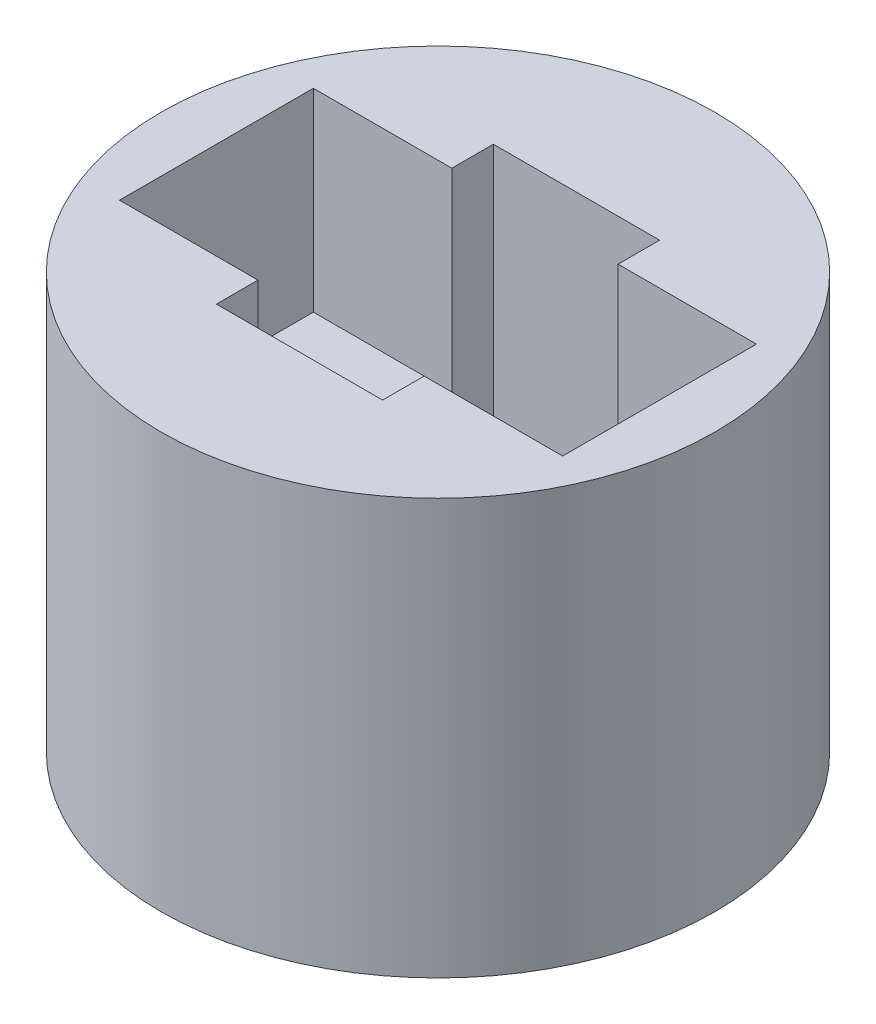
from build123d import *

# Parameters (mm, degrees)
CROQUIS1_W            = 5
CROQUIS1_H            = 7.5
CORTAR_EXTRUIR1_DEPTH = 11.307764064
CROQUIS3_W            = 8
CROQUIS3_H            = 3.5
CORTAR_EXTRUIR2_DEPTH = 3.5


with BuildPart() as part:
    # Croquis1 → Revolución1 (revolve)
    with BuildSketch(Plane.XY):
        with Locations((2.5, 3.75)):
            Rectangle(CROQUIS1_W, CROQUIS1_H)
    revolve(axis=Axis((0, 0, 0), (0, 1, 0)))

    # Croquis2 → Cortar-Extruir1 (cut, through all)
    with BuildSketch(Plane(origin=(0, 7.5, 0), x_dir=(1, 0, 0), z_dir=(0, 1, 0))):
        with BuildLine():
            Line((-1.5, 0.5), (-2.5, 0.5))
            ThreePointArc((-2.5, 0.5), (-3, 0), (-2.5, -0.5))
            Line((-2.5, -0.5), (-1.5, -0.5))
            Line((-1.5, -0.5), (-1.5, -2.5))
            Line((-1.5, -2.5), (1.5, -2.5))
            Line((1.5, -2.5), (1.5, -0.5))
            Line((1.5, -0.5), (2.5, -0.5))
            ThreePointArc((2.5, -0.5), (3, 0), (2.5, 0.5))
            Line((2.5, 0.5), (1.5, 0.5))
            Line((1.5, 0.5), (1.5, 2.5))
            Line((1.5, 2.5), (-1.5, 2.5))
            Line((-1.5, 2.5), (-1.5, 0.5))
        make_face()
    extrude(amount=-CORTAR_EXTRUIR1_DEPTH, mode=Mode.SUBTRACT)

    # Croquis3 → Cortar-Extruir2 (cut)
    with BuildSketch(Plane(origin=(0, 7.5, 0), x_dir=(1, 0, 0), z_dir=(0, 1, 0))):
        Rectangle(CROQUIS3_W, CROQUIS3_H)
    extrude(amount=-CORTAR_EXTRUIR2_DEPTH, mode=Mode.SUBTRACT)


solid = part.part
